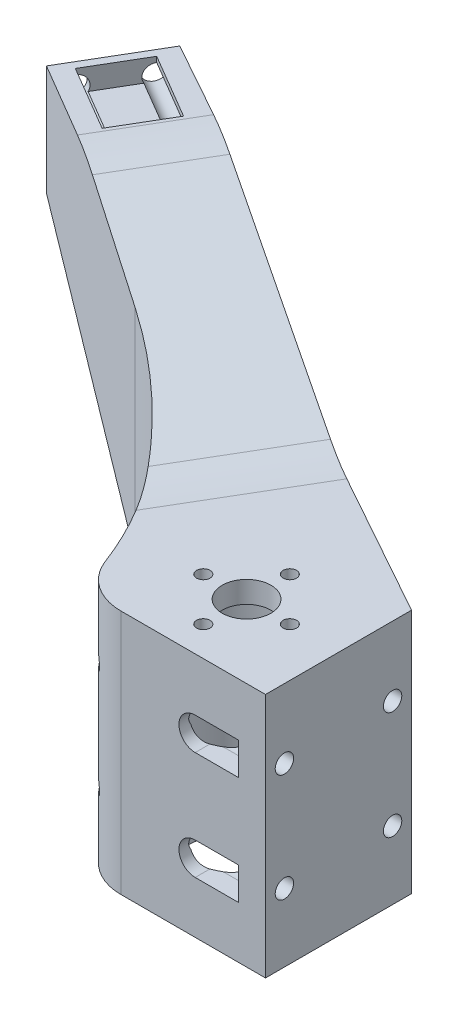
from build123d import *

# Parameters (mm, degrees)
BOSS_EXTRUDE1_DEPTH                             = 60.4
CUT_EXTRUDE1_START                              = -19
SKETCH2_R                                       = 11.5
CUT_EXTRUDE1_DEPTH                              = 55.4
SKETCH4_R                                       = 4.500000000000002
CUT_EXTRUDE3_DEPTH                              = 55.4
SKETCH6_R                                       = 1.9999999999999996
SKETCH6_R_2                                     = 2.0000000000000027
CUT_EXTRUDE5_DEPTH                              = 20
CUT_EXTRUDE6_DEPTH                              = 4
TAP_DRILL_FOR_M3X0_5_TAP1_D                     = 2.5
CUT_EXTRUDE7_DEPTH                              = 15
CUT_EXTRUDE8_DEPTH                              = 134.76469025068354
FILLET1_R                                       = 70
FILLET2_R                                       = 9.999999999999996
CHAMFER1_SIZE                                   = 40
CHAMFER1_SIZE2                                  = 70
FILLET3_R                                       = 30
M3_CLEARANCE_HOLE1_D                            = 3.4
CUT_EXTRUDE9_START                              = -5
CUT_EXTRUDE9_DEPTH                              = 8
SKETCH19_R                                      = 3.0000000000000036
CUT_EXTRUDE10_DEPTH                             = 147.31183830720573
CSK_FOR_M2_FLAT_HEAD_MACHINE_SCREW1_D           = 5.0546
CSK_FOR_M2_FLAT_HEAD_MACHINE_SCREW1_DEPTH       = 6
CSK_FOR_M2_FLAT_HEAD_MACHINE_SCREW1_CSINK_D     = 5.6
CSK_FOR_M2_FLAT_HEAD_MACHINE_SCREW1_CSINK_ANGLE = 70
CSK_FOR_M2_FLAT_HEAD_MACHINE_SCREW1_TIP         = 1.5185550424683532


with BuildPart() as part:
    # Sketch1 → Boss-Extrude1 (new body)
    with BuildSketch(Plane(origin=(0, 0, 0), x_dir=(1, 0, 0), z_dir=(0, 1, 0))):
        Polygon((0, 0), (3.31e-15, -26.999999999999996), (-34, -27.000000000000004), (-40.52499719098998, -0.08584585353128144), (-105.89087117932097, 38.396574003003145), (-96.75888453325587, 53.90808005161391), align=None)
    extrude(amount=-BOSS_EXTRUDE1_DEPTH)

    # Sketch2 → Cut-Extrude1 (cut)
    with BuildSketch(Plane(origin=(0, 0, 0), x_dir=(1, 0, 0), z_dir=(0, 1, 0)).offset(CUT_EXTRUDE1_START)):
        with Locations(Location((-17, -13.499999999999998, 0), (0, 0, 270))):
            Circle(SKETCH2_R)
    extrude(amount=-CUT_EXTRUDE1_DEPTH, mode=Mode.SUBTRACT)

    # Sketch4 → Cut-Extrude3 (cut)
    with BuildSketch(Plane(origin=(0, 0, 0), x_dir=(1, 0, 0), z_dir=(0, 1, 0))):
        with Locations(Location((-17, -13.499999999999998, 0), (0, 0, 270))):
            Circle(SKETCH4_R)
    extrude(amount=-CUT_EXTRUDE3_DEPTH, mode=Mode.SUBTRACT)

    # Sketch6 → Cut-Extrude5 (cut)
    with BuildSketch(Plane(origin=(-95.42275843561049, 0, -56.177611189645546), x_dir=(-0.5073325914480615, 0, 0.8617503360339318), z_dir=(-0.8617503360339319, 0, -0.5073325914480615))):
        with Locations((6.133629536458064, -3.0000000000000027)):
            Circle(SKETCH6_R)
        with Locations(Location((17.133629536458084, -3.0000000000000027, 0), (0, 0, 180))):
            Circle(SKETCH6_R_2)
    extrude(amount=-CUT_EXTRUDE5_DEPTH, mode=Mode.SUBTRACT)

    # Sketch7 → Cut-Extrude6 (cut)
    with BuildSketch(Plane(origin=(0, 0, 0), x_dir=(1, 0, 0), z_dir=(0, 1, 0))):
        Polygon((-97.2419230992732, 50.13095498832306), (-85.17741839479814, 43.0282987080502), (-90.75587249495916, 33.55278939444095), (-102.8203771994342, 40.65544567471381), align=None)
    extrude(amount=-CUT_EXTRUDE6_DEPTH, mode=Mode.SUBTRACT)

    # Tap Drill for M3x0.5 Tap1 (through all)
    with Locations(Plane(origin=(0, 0, 0), x_dir=(1, 0, 0), z_dir=(0, 1, 0))):
        with Locations((-9, -13.5), (-17, -21.5), (-25, -13.5), (-17, -5.5), (-17, -13.5)):
            Hole(TAP_DRILL_FOR_M3X0_5_TAP1_D / 2)

    # Sketch1<5> → Cut-Extrude7 (cut)
    with BuildSketch(Plane(origin=(0, 0, 0), x_dir=(1, 0, 0), z_dir=(0, 1, 0))):
        Polygon((3.31e-15, -26.999999999999996), (0, 0), (-30.477746182805802, 16.980319574175848), (-40.52499719098998, -0.08584585353128144), (-34, -27.000000000000004), align=None)
    extrude(amount=-CUT_EXTRUDE7_DEPTH, mode=Mode.SUBTRACT)

    # Sketch13 → Cut-Extrude8 (cut, through all)
    with BuildSketch(Plane(origin=(-10.468112743710531, 0, 17.781037186642397), x_dir=(0.8617503360339318, 0, 0.5073325914480615), z_dir=(-0.5073325914480615, 0, 0.8617503360339319))):
        Polygon((-34.878877547772646, -15), (-34.878877547772646, 0), (-90.60323024246308, 0), align=None)
    extrude(amount=-CUT_EXTRUDE8_DEPTH, mode=Mode.SUBTRACT)

    # Fillet1
    # the kernel refuses this fillet: 70 mm, written as the material it adds along each edge
    with BuildSketch(Plane(origin=(-40.52499719098998, 58.98171562228927, 0.08584585353128205), x_dir=(0.23561209057860208, 0, 0.9718471807713293), z_dir=(0, -1, 0))) as fillet1_piece_1_section:
        with BuildLine():
            CenterArc((29.65778597683332, 69.9724432214505), FILLET1_R, 224.11402392280027, 44.27823139534951)
            Line((-20.59912997111761, 21.246244935512), (-21.604268290076625, 20.271720969793225))
            Line((-21.604268290076625, 20.271720969793225), (-1.0051383189590186, -0.9745239657187709))
            Line((-1.0051383189590186, -0.9745239657187709), (-1.086e-14, -1.3999999999999984))
            ThreePointArc((-1.086e-14, -1.3999999999999984), (13.846906529639622, -1.4000000000001014), (27.65453360092819, -1.3994488644290128))
            Line((27.65453360092819, -1.3994488644290128), (27.693813059279268, -4e-17))
        make_face()
    fillet1_piece_1 = extrude(amount=119.38171562228928, mode=Mode.PRIVATE)
    fillet1_piece_1 = split(fillet1_piece_1, bisect_by=Plane(origin=(-54.6492128858331, -15, -8.04492280764504), z_dir=(0, 1, 0)), keep=Keep.TOP, mode=Mode.PRIVATE)
    fillet1_piece_1 = split(fillet1_piece_1, bisect_by=Plane(origin=(-54.17479732212434, -10.761451162357448, -7.765623261946722), z_dir=(-0.22399448989054827, -0.9656275477477114, -0.13187079862279721)), keep=Keep.TOP, mode=Mode.PRIVATE)
    add(fillet1_piece_1)
    with BuildSketch(Plane(origin=(-40.52499719098998, -15, 0.08584585353128144), x_dir=(0.23561209057860208, 0, 0.9718471807713293), z_dir=(0, -1, 0))) as fillet1_piece_2_section:
        with BuildLine():
            CenterArc((29.65778597683332, 69.9724432214505), FILLET1_R, 224.11402392280027, 44.27823139534951)
            Line((-20.59912997111761, 21.246244935512), (-21.604268290076625, 20.271720969793225))
            Line((-21.604268290076625, 20.271720969793225), (-1.0051383189590186, -0.9745239657187709))
            Line((-1.0051383189590186, -0.9745239657187709), (-1.086e-14, -1.3999999999999984))
            ThreePointArc((-1.086e-14, -1.3999999999999984), (13.846906529639622, -1.4000000000001014), (27.65453360092819, -1.3994488644290128))
            Line((27.65453360092819, -1.3994488644290128), (27.693813059279268, -4e-17))
        make_face()
    fillet1_piece_2 = extrude(amount=45.4, mode=Mode.PRIVATE)
    fillet1_piece_2 = split(fillet1_piece_2, bisect_by=Plane(origin=(-36.99091535572733, -17.93757854257767, 15.593387536917515), z_dir=(0.22399448989054827, 0.9656275477477114, 0.13187079862279721)), keep=Keep.TOP, mode=Mode.PRIVATE)
    add(fillet1_piece_2)
    with BuildSketch(Plane(origin=(-40.52499719098998, -15, 0.08584585353128144), x_dir=(0.23561209057860208, 0, 0.9718471807713293), z_dir=(0, -1, 0))) as fillet1_piece_3_section:
        with BuildLine():
            CenterArc((29.65778597683332, 69.9724432214505), FILLET1_R, 224.11402392280027, 44.27823139534951)
            Line((-20.59912997111761, 21.246244935512), (-21.604268290076625, 20.271720969793225))
            Line((-21.604268290076625, 20.271720969793225), (-1.0051383189590186, -0.9745239657187709))
            Line((-1.0051383189590186, -0.9745239657187709), (-1.086e-14, -1.3999999999999984))
            ThreePointArc((-1.086e-14, -1.3999999999999984), (13.846906529639622, -1.4000000000001014), (27.65453360092819, -1.3994488644290128))
            Line((27.65453360092819, -1.3994488644290128), (27.693813059279268, -4e-17))
        make_face()
    fillet1_piece_3 = extrude(amount=45.4, mode=Mode.PRIVATE)
    fillet1_piece_3 = split(fillet1_piece_3, bisect_by=Plane(origin=(-39.63216951105284, -15.930497237518985, 5.382888809355432), z_dir=(-0.22399448989054827, -0.9656275477477114, -0.13187079862279721)), keep=Keep.TOP, mode=Mode.PRIVATE)
    add(fillet1_piece_3)

    # Fillet2
    fillet2_edges = [part.edges().sort_by_distance(p)[0] for p in [
        (-33.99999999999396, -37.7, 26.999999999998312),
    ]]
    fillet(fillet2_edges, radius=FILLET2_R)

    # Chamfer1
    chamfer1_edges = [part.edges().sort_by_distance(p)[0] for p in [
        (-101.32487785628842, -60.4, -46.15232702730852),
    ]]
    chamfer1_side = [part.faces().sort_by_distance(p)[0] for p in [
        (-101.32487785628841, -30.84366032920741, -46.15232702730852),
    ]]
    chamfer(chamfer1_edges, length=CHAMFER1_SIZE, length2=CHAMFER1_SIZE2, reference=chamfer1_side[0])

    # Fillet3
    fillet3_edges = [part.edges().sort_by_distance(p)[0] for p in [
        (-83.85804691036842, 0, -36.14695851879114),
        (-41.63240209085213, -60.4, -9.568852471765327),
        (-35.50137168689788, -15, -8.447236860322283),
    ]]
    fillet(fillet3_edges, radius=FILLET3_R)

    # M3 Clearance Hole1 (through all)
    with Locations(Plane(origin=(0, 0, 0), x_dir=(-1.2e-16, 0, -1), z_dir=(1, 0, -1.2e-16))):
        with Locations((-23.5, -47.8), (-3.5, -47.8), (-3.5, -27.8), (-23.5, -27.8)):
            Hole(M3_CLEARANCE_HOLE1_D / 2)

    # Sketch16 → Cut-Extrude9 (cut)
    with BuildSketch(Plane(origin=(0, 0, 0), x_dir=(-1.2e-16, 0, -1), z_dir=(1, 0, -1.2e-16)).offset(CUT_EXTRUDE9_START)):
        with BuildLine():
            Line((-23.500000000000068, -24.799999999999994), (-34.63933937634707, -24.799999999999994))
            Line((-34.63933937634707, -24.799999999999994), (-34.63933937634707, -30.799999999999997))
            Line((-34.63933937634707, -30.799999999999997), (-23.500000000000068, -30.799999999999997))
            ThreePointArc((-23.500000000000068, -30.799999999999997), (-20.500000000000064, -27.799999999999994), (-23.500000000000068, -24.799999999999994))
        make_face()
        with BuildLine():
            Line((-23.499999999999996, -50.8), (-34.639339376347, -50.8))
            Line((-34.639339376347, -50.8), (-34.639339376347, -44.79999999999999))
            Line((-34.639339376347, -44.79999999999999), (-23.499999999999996, -44.79999999999999))
            ThreePointArc((-23.499999999999996, -44.79999999999999), (-20.499999999999996, -47.8), (-23.499999999999996, -50.8))
        make_face()
        with BuildLine():
            Line((7.639339376347073, -30.799999999999997), (7.639339376347073, -24.799999999999994))
            Line((7.639339376347073, -24.799999999999994), (-3.4999999999999303, -24.799999999999994))
            ThreePointArc((-3.4999999999999303, -24.799999999999994), (-6.499999999999934, -27.799999999999994), (-3.4999999999999303, -30.799999999999997))
            Line((-3.4999999999999303, -30.799999999999997), (7.639339376347073, -30.799999999999997))
        make_face()
        with BuildLine():
            Line((7.639339376347004, -50.8), (7.639339376347004, -44.79999999999999))
            Line((7.639339376347004, -44.79999999999999), (-3.4999999999999996, -44.79999999999999))
            ThreePointArc((-3.4999999999999996, -44.79999999999999), (-6.5, -47.8), (-3.4999999999999996, -50.8))
            Line((-3.4999999999999996, -50.8), (7.639339376347004, -50.8))
        make_face()
    extrude(amount=-CUT_EXTRUDE9_DEPTH, mode=Mode.SUBTRACT)

    # Sketch19 → Cut-Extrude10 (cut, through all)
    with BuildSketch(Plane.XY.offset(26.999999999999996)):
        with Locations((-13.000000000000004, -27.799999999999994)):
            Circle(SKETCH19_R)
        with Locations((-13.000000000000004, -47.8)):
            Circle(SKETCH19_R)
    extrude(amount=-CUT_EXTRUDE10_DEPTH, mode=Mode.SUBTRACT)

    # CSK for M2 Flat Head Machine Screw1
    with Locations(Plane(origin=(-95.42275843561049, 0, -56.177611189645546), x_dir=(-0.5073325914480615, 0, 0.8617503360339318), z_dir=(-0.8617503360339319, 0, -0.5073325914480615))):
        with Locations((11.633629536, -11)):
            CounterSinkHole(CSK_FOR_M2_FLAT_HEAD_MACHINE_SCREW1_D / 2, CSK_FOR_M2_FLAT_HEAD_MACHINE_SCREW1_CSINK_D / 2, depth=CSK_FOR_M2_FLAT_HEAD_MACHINE_SCREW1_DEPTH, counter_sink_angle=CSK_FOR_M2_FLAT_HEAD_MACHINE_SCREW1_CSINK_ANGLE)
            with Locations((0, 0, -(CSK_FOR_M2_FLAT_HEAD_MACHINE_SCREW1_DEPTH + CSK_FOR_M2_FLAT_HEAD_MACHINE_SCREW1_TIP / 2))):  # 118° drill point
                Cone(0, CSK_FOR_M2_FLAT_HEAD_MACHINE_SCREW1_D / 2, CSK_FOR_M2_FLAT_HEAD_MACHINE_SCREW1_TIP, mode=Mode.SUBTRACT)


solid = part.part
